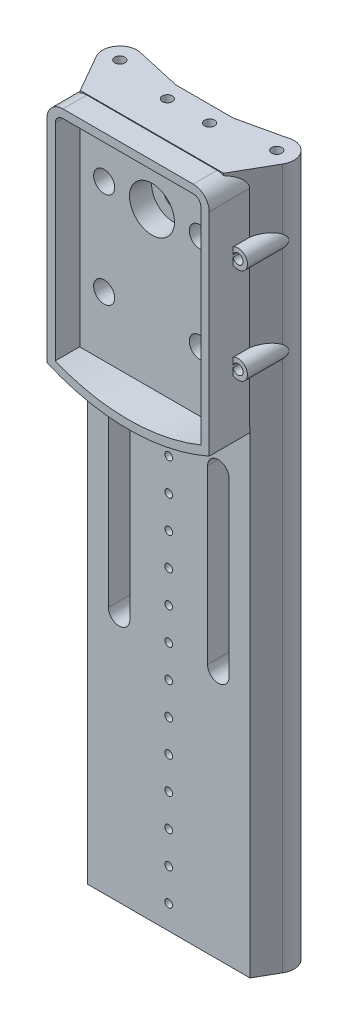
from build123d import *
from build123d.topology import SkipClean

# Parameters (mm, degrees)
SKETCH_2_W             = 60
SKETCH_2_H             = 90
SKETCH_2_R             = 4.4
EXTRUDE_1_DEPTH        = 7
SKETCH_3_R             = 9.4
CUT_EXTRUDE_1_DEPTH    = 29
EXTRUDE_START          = 0.2
SKETCH_5_W             = 60
SKETCH_5_H             = 90
SKETCH_5_R             = 9.4
SKETCH_5_R_2           = 4.4
EXTRUDE_2_DEPTH        = 0.2
SKETCH_6_R             = 6.4
SKETCH_6_R_2           = 2.2
EXTRUDE_3_DEPTH        = 5
SKETCH_8_R             = 10.4
SKETCH_8_R_2           = 9.4
EXTRUDE_4_DEPTH        = 2
SKETCH_9_R             = 6.2
SKETCH_9_R_2           = 4.2
EXTRUDE_6_DEPTH        = 87
EXTRUDE_6_2_DEPTH      = 87
EXTRUDE_6_3_DEPTH      = 87
EXTRUDE_6_4_DEPTH      = 87
EXTRUDE_START_2        = -90
EXTRUDE_11_OUTLINE_R   = 4.2
EXTRUDE_11_DEPTH       = 90
SKETCH_10_R            = 4.2
CUT_EXTRUDE_2_DEPTH    = 74
CUT_EXTRUDE_START      = -9.2
SKETCH_12_R            = 9.4
CUT_EXTRUDE_3_DEPTH    = 9.2
SKETCH_13_R            = 5.394379646
SKETCH_13_R_2          = 5.554961838
EXTRUDE_13_DEPTH       = 5
SKETCH_14_R            = 2.1
SKETCH_14_R_2          = 4.2
CUT_EXTRUDE_4_DEPTH    = 88
SKETCH_15_R            = 2.1
EXTRUDE_16_DEPTH       = 3
EXTRUDE_START_3        = 200
SKETCH_16_R            = 4.2
EXTRUDE_17_DEPTH       = 200
EXTRUDE_19_DEPTH       = 10
SKETCH_26_R            = 1.6
CUT_EXTRUDE_5_DEPTH    = 30
SKETCH_28_R            = 1.6
CUT_EXTRUDE_6_DEPTH    = 250.016385003
PATTERN_LINEAR_1_COUNT = 10
PATTERN_LINEAR_1_PITCH = 13.5
CUT_EXTRUDE_7_DEPTH    = 250.016385003
SKETCH_33_R            = 1.6
CUT_EXTRUDE_8_DEPTH    = 250.016385003
EXTRUDE_20_REACH       = 251.665
SKETCH_34_R            = 3.927985286
SKETCH_34_R_2          = 2.1
EXTRUDE_21_REACH       = 251.665
SKETCH_36_R            = 3.927985286
SKETCH_36_R_2          = 2.1


# Read off the part's stored shape, not the designer's step: 凸台-拉伸11
with BuildPart() as part:
    # 草图2 → 凸台-拉伸1 (new body)
    with BuildSketch(Plane.XY):
        Rectangle(SKETCH_2_W, SKETCH_2_H)
        with Locations((20, 20)):
            Circle(SKETCH_2_R, mode=Mode.SUBTRACT)
        with Locations((-20, 20)):
            Circle(SKETCH_2_R, mode=Mode.SUBTRACT)
        with Locations((-20, -20)):
            Circle(SKETCH_2_R, mode=Mode.SUBTRACT)
        with Locations((20, -20)):
            Circle(SKETCH_2_R, mode=Mode.SUBTRACT)
    extrude(amount=EXTRUDE_1_DEPTH)

    # 草图3 → 切除-拉伸1 (cut)
    with BuildSketch(Plane(origin=(0, 0, 0), x_dir=(-1, 0, 0), z_dir=(0, 0, -1))):
        with Locations((0, 20)):
            Circle(SKETCH_3_R)
    extrude(amount=-CUT_EXTRUDE_1_DEPTH, mode=Mode.SUBTRACT)

    # 草图5 → 凸台-拉伸2 (add)
    with SkipClean():  # the faces are left unmerged after this step: merging them gives an invalid solid
        with BuildSketch(Plane(origin=(0, 0, 0), x_dir=(-1, 0, 0), z_dir=(0, 0, -1)).offset(EXTRUDE_START)):
            Rectangle(SKETCH_5_W, SKETCH_5_H)
            with Locations((0, 20)):
                Circle(SKETCH_5_R, mode=Mode.SUBTRACT)
            with Locations((-20, 20)):
                Circle(SKETCH_5_R_2, mode=Mode.SUBTRACT)
            with Locations((20, 20)):
                Circle(SKETCH_5_R_2, mode=Mode.SUBTRACT)
            with Locations((-20, -20)):
                Circle(SKETCH_5_R_2, mode=Mode.SUBTRACT)
            with Locations((20, -20)):
                Circle(SKETCH_5_R_2, mode=Mode.SUBTRACT)
        extrude(amount=-EXTRUDE_2_DEPTH)

    # 草图6 → 凸台-拉伸3 (add)
    # profile 1 of 4: a face of its own
    with SkipClean():  # the faces are left unmerged after this step: merging them gives an invalid solid
        with BuildSketch(Plane(origin=(0, 0, -0.2), x_dir=(-1, 0, 0), z_dir=(0, 0, -1))):
            with Locations((-20, 20)):
                Circle(SKETCH_6_R)
            with Locations((-20, 20)):
                Circle(SKETCH_6_R_2, mode=Mode.SUBTRACT)
        # profile 2 of 4: a face of its own
        with BuildSketch(Plane(origin=(0, 0, -0.2), x_dir=(-1, 0, 0), z_dir=(0, 0, -1))):
            with Locations((20, 20)):
                Circle(SKETCH_6_R)
            with Locations((20, 20)):
                Circle(SKETCH_6_R_2, mode=Mode.SUBTRACT)
        # profile 3 of 4: a face of its own
        with BuildSketch(Plane(origin=(0, 0, -0.2), x_dir=(-1, 0, 0), z_dir=(0, 0, -1))):
            with Locations((-20, -20)):
                Circle(SKETCH_6_R)
            with Locations((-20, -20)):
                Circle(SKETCH_6_R_2, mode=Mode.SUBTRACT)
        # profile 4 of 4: a face of its own
        with BuildSketch(Plane(origin=(0, 0, -0.2), x_dir=(-1, 0, 0), z_dir=(0, 0, -1))):
            with Locations((20, -20)):
                Circle(SKETCH_6_R)
            with Locations((20, -20)):
                Circle(SKETCH_6_R_2, mode=Mode.SUBTRACT)
        extrude(amount=EXTRUDE_3_DEPTH)

    # 草图8 → 凸台-拉伸4 (add)
    with SkipClean():  # the faces are left unmerged after this step: merging them gives an invalid solid
        with BuildSketch(Plane(origin=(0, 0, -0.2), x_dir=(-1, 0, 0), z_dir=(0, 0, -1))):
            with Locations((-0.054578781, 20.238018036)):
                Circle(SKETCH_8_R)
            with Locations(Location((-0.054578781, 20.238018036, 0), (0, 0, 193.659194288))):
                Circle(SKETCH_8_R_2, mode=Mode.SUBTRACT)
        extrude(amount=EXTRUDE_4_DEPTH)



with BuildPart() as body_2:
    # 草图9 → 凸台-拉伸6 (new body)
    with BuildSketch(Plane.XZ.offset(45)):
        with Locations(Location((32.8, -12.4, 0), (0, 0, 270))):
            Circle(SKETCH_9_R)
        with Locations(Location((32.8, -12.4, 0), (0, 0, 270))):
            Circle(SKETCH_9_R_2, mode=Mode.SUBTRACT)
    extrude(amount=-EXTRUDE_6_DEPTH)


with BuildPart() as body_3:
    # 草图9 → Extrude 6 2 (new body)
    with BuildSketch(Plane.XZ.offset(45)):
        with Locations(Location((-32.727985286, -12.279985317, 0), (0, 0, 90))):
            Circle(SKETCH_9_R)
        with Locations(Location((-32.727985286, -12.279985317, 0), (0, 0, 90))):
            Circle(SKETCH_9_R_2, mode=Mode.SUBTRACT)
    extrude(amount=-EXTRUDE_6_2_DEPTH)


with BuildPart() as body_4:
    # 草图9 → Extrude 6 3 (new body)
    with BuildSketch(Plane.XZ.offset(45)):
        with BuildLine():
            Line((8.866995315, -4.032292114), (10.646326686, -3.444094386))
            Line((10.646326686, -3.444094386), (12.412827061, -4.710086322))
            Line((12.412827061, -4.710086322), (13.914352381, -7.919228671))
            Line((13.914352381, -7.919228671), (13.354960595, -12.432263937))
            Line((13.354960595, -12.432263937), (12.736803026, -14.246535718))
            Line((12.736803026, -14.246535718), (8.829632785, -14.232223684))
            Line((8.829632785, -14.232223684), (8.836226172, -12.43223576))
            ThreePointArc((8.836226172, -12.43223576), (13.051582567, -8.247648508), (8.866995315, -4.032292114))
        make_face()
    extrude(amount=-EXTRUDE_6_3_DEPTH)


with BuildPart() as body_5:
    # 草图9 → Extrude 6 4 (new body)
    with BuildSketch(Plane.XZ.offset(45)):
        with BuildLine():
            Line((-8.764490306, -4), (-10.541655175, -3.405288539))
            Line((-10.541655175, -3.405288539), (-12.312781019, -4.664801303))
            Line((-12.312781019, -4.664801303), (-13.826051332, -7.868422046))
            Line((-13.826051332, -7.868422046), (-13.283194516, -12.383476083))
            Line((-13.283194516, -12.383476083), (-12.671686759, -14.2))
            Line((-12.671686759, -14.2), (-8.764490306, -14.2))
            Line((-8.764490306, -14.2), (-8.764490306, -12.4))
            ThreePointArc((-8.764490306, -12.4), (-12.964490306, -8.2), (-8.764490306, -4))
        make_face()
    extrude(amount=-EXTRUDE_6_4_DEPTH)


with BuildPart() as part_1:
    with SkipClean():  # the faces are left unmerged after this step: merging them gives an invalid solid
        add(part.part)

        add(body_2.part)  # 凸台-拉伸11 merges body 2

        add(body_3.part)  # 凸台-拉伸11 merges body 3

        add(body_4.part)  # 凸台-拉伸11 merges body 4

        add(body_5.part)  # 凸台-拉伸11 merges body 5
        # 凸台-拉伸11 outline → 凸台-拉伸11 (add)
        with BuildSketch(Plane(origin=(0, 45, 0), x_dir=(1, 0, 0), z_dir=(0, 1, 0)).offset(EXTRUDE_START_2)):
            with BuildLine():
                Line((12, 15), (-12, 15))
                Line((-12, 15), (-31.148828374, 19.304674879))
                ThreePointArc((-31.148828374, 19.304674879), (-38.518924765, 16.558421942), (-38.978742897, 8.706747388))
                Line((-38.978742897, 8.706747388), (-30, -7))
                Line((-30, -7), (-30, 0.2))
                Line((-30, 0.2), (30, 0.2))
                Line((30, 0.2), (30, -7))
                Line((30, -7), (38.945754269, 8.649039527))
                ThreePointArc((38.945754269, 8.649039527), (38.279214713, 17.070996267), (30.068858697, 19.061896666))
                Line((30.068858697, 19.061896666), (12, 15))
            make_face()
            with Locations((-8.764490306, 8.2)):
                Circle(EXTRUDE_11_OUTLINE_R, mode=Mode.SUBTRACT)
            with Locations((8.851610744, 8.232263937)):
                Circle(EXTRUDE_11_OUTLINE_R, mode=Mode.SUBTRACT)
            with Locations((-32.727985286, 12.279985317)):
                Circle(EXTRUDE_11_OUTLINE_R, mode=Mode.SUBTRACT)
            with Locations((32.8, 12.4)):
                Circle(EXTRUDE_11_OUTLINE_R, mode=Mode.SUBTRACT)
        extrude(amount=EXTRUDE_11_DEPTH)

    # 草图10 → 切除-拉伸2 (cut)
    with SkipClean():  # the faces are left unmerged after this step: merging them gives an invalid solid
        with BuildSketch(Plane(origin=(0, 0, -0.2), x_dir=(-1, 0, 0), z_dir=(0, 0, -1))):
            with Locations((-20, 20)):
                Circle(SKETCH_10_R)
            with Locations(Location((20, 20, 0), (0, 0, 180))):
                Circle(SKETCH_10_R)
            with Locations(Location((20, -20, 0), (0, 0, 180))):
                Circle(SKETCH_10_R)
            with Locations(Location((-20, -20, 0), (0, 0, 180))):
                Circle(SKETCH_10_R)
        extrude(amount=CUT_EXTRUDE_2_DEPTH, mode=Mode.SUBTRACT)

    # 草图12 → 切除-拉伸3 (cut)
    with SkipClean():  # the faces are left unmerged after this step: merging them gives an invalid solid
        with BuildSketch(Plane.XY.offset(7).offset(CUT_EXTRUDE_START)):
            with Locations((0, 20)):
                Circle(SKETCH_12_R)
        extrude(amount=CUT_EXTRUDE_3_DEPTH, mode=Mode.SUBTRACT)

    # 草图13 → 凸台-拉伸13 (add)
    with SkipClean():  # the faces are left unmerged after this step: merging them gives an invalid solid
        with BuildSketch(Plane.XY.offset(-0.2)):
            with Locations((-20, 20)):
                Circle(SKETCH_13_R)
            with Locations((-20, -20)):
                Circle(SKETCH_13_R_2)
            with Locations((20, -20)):
                Circle(SKETCH_13_R_2)
            with Locations((20, 20)):
                Circle(SKETCH_13_R)
        extrude(amount=-EXTRUDE_13_DEPTH)

    # 草图14 → 切除-拉伸4 (cut)
    with SkipClean():  # the faces are left unmerged after this step: merging them gives an invalid solid
        with BuildSketch(Plane.XY.offset(7)):
            with Locations((-20, 20)):
                Circle(SKETCH_14_R)
            with Locations(Location((20, 20, 0), (0, 0, 180))):
                Circle(SKETCH_14_R)
            with Locations(Location((20, -20, 0), (0, 0, 180))):
                Circle(SKETCH_14_R)
            with Locations((-20, -20)):
                Circle(SKETCH_14_R)
            with Locations((0, 20)):
                Circle(SKETCH_14_R_2)
        extrude(amount=-CUT_EXTRUDE_4_DEPTH, mode=Mode.SUBTRACT)

    # 草图15 → 凸台-拉伸16 (add)
    with SkipClean():  # the faces are left unmerged after this step: merging them gives an invalid solid
        with BuildSketch(Plane(origin=(0, 45, 0), x_dir=(1, 0, 0), z_dir=(0, 1, 0))):
            with BuildLine():
                Line((30.068858697, 19.061896666), (12, 15))
                Line((12, 15), (-12, 15))
                Line((-12, 15), (-31.148828374, 19.304674879))
                ThreePointArc((-31.148828374, 19.304674879), (-38.518924765, 16.558421942), (-38.978742897, 8.706747388))
                Line((-38.978742897, 8.706747388), (-30, -7))
                Line((-30, -7), (30, -7))
                Line((30, -7), (38.945754269, 8.649039527))
                ThreePointArc((38.945754269, 8.649039527), (38.279214713, 17.070996267), (30.068858697, 19.061896666))
            make_face()
            with Locations(Location((-32.727985286, 12.279985317, 0), (0, 0, 270))):
                Circle(SKETCH_15_R, mode=Mode.SUBTRACT)
            with Locations(Location((-8.764490306, 8.2, 0), (0, 0, 270))):
                Circle(SKETCH_15_R, mode=Mode.SUBTRACT)
            with Locations(Location((8.851610744, 8.232263937, 0), (0, 0, 270))):
                Circle(SKETCH_15_R, mode=Mode.SUBTRACT)
            with Locations(Location((32.8, 12.4, 0), (0, 0, 270))):
                Circle(SKETCH_15_R, mode=Mode.SUBTRACT)
        extrude(amount=EXTRUDE_16_DEPTH)

    # 草图16 → 凸台-拉伸17 (add)
    with SkipClean():  # the faces are left unmerged after this step: merging them gives an invalid solid
        with BuildSketch(Plane.XZ.offset(45).offset(EXTRUDE_START_3)):
            with BuildLine():
                Line((-34.001541422, 0), (34.001541422, 0))
                Line((34.001541422, 0), (38.945754269, -8.649039527))
                ThreePointArc((38.945754269, -8.649039527), (38.279214713, -17.070996267), (30.068858697, -19.061896666))
                Line((30.068858697, -19.061896666), (12, -15))
                Line((12, -15), (-12, -15))
                Line((-12, -15), (-31.148828374, -19.304674879))
                ThreePointArc((-31.148828374, -19.304674879), (-38.518924765, -16.558421942), (-38.978742897, -8.706747388))
                Line((-38.978742897, -8.706747388), (-34.001541422, 0))
            make_face()
            with Locations(Location((-32.727985286, -12.279985317, 0), (0, 0, 90))):
                Circle(SKETCH_16_R, mode=Mode.SUBTRACT)
            with Locations(Location((-8.764490306, -8.2, 0), (0, 0, 90))):
                Circle(SKETCH_16_R, mode=Mode.SUBTRACT)
            with Locations(Location((8.851610744, -8.232263937, 0), (0, 0, 90))):
                Circle(SKETCH_16_R, mode=Mode.SUBTRACT)
            with Locations(Location((32.8, -12.4, 0), (0, 0, 90))):
                Circle(SKETCH_16_R, mode=Mode.SUBTRACT)
        extrude(amount=-EXTRUDE_17_DEPTH)

    # 草图24 → 凸台-拉伸19 (add, symmetric)
    with SkipClean():  # the faces are left unmerged after this step: merging them gives an invalid solid
        with BuildSketch(Plane.XY.offset(7)):
            with BuildLine():
                Line((-27.25, 47.7), (27.25, 47.7))
                ThreePointArc((27.25, 47.7), (31.987615434, 45.737615434), (33.95, 41))
                Line((33.95, 41), (33.95, -47.50547366))
                ThreePointArc((33.95, -47.50547366), (0, -54.7), (-33.95, -47.50547366))
                Line((-33.95, -47.50547366), (-33.95, 41))
                ThreePointArc((-33.95, 41), (-31.987615434, 45.737615434), (-27.25, 47.7))
            make_face()
            with BuildLine():
                Line((-27.25, 44.2), (27.25, 44.2))
                ThreePointArc((27.25, 44.2), (29.5127417, 43.2627417), (30.45, 41))
                Line((30.45, 41), (30.45, -45.194592121))
                ThreePointArc((30.45, -45.194592121), (0, -51.2), (-30.45, -45.194592121))
                Line((-30.45, -45.194592121), (-30.45, 41))
                ThreePointArc((-30.45, 41), (-29.5127417, 43.2627417), (-27.25, 44.2))
            make_face(mode=Mode.SUBTRACT)
        extrude(amount=EXTRUDE_19_DEPTH, both=True)

    # 草图26 → 切除-拉伸5 (cut)
    with SkipClean():  # the faces are left unmerged after this step: merging them gives an invalid solid
        with BuildSketch(Plane.XY):
            with Locations((0, -208)):
                Circle(SKETCH_26_R)
            with Locations((0, -235)):
                Circle(SKETCH_26_R)
        extrude(amount=-CUT_EXTRUDE_5_DEPTH, mode=Mode.SUBTRACT)

    # 草图28 → 切除-拉伸6 (cut, through all)
    with SkipClean():  # the faces are left unmerged after this step: merging them gives an invalid solid
        with BuildSketch(Plane.XY):
            with Locations((0, -194.5)):
                Circle(SKETCH_28_R)
        cut_extrude_6 = extrude(amount=-CUT_EXTRUDE_6_DEPTH, mode=Mode.SUBTRACT)

    # 阵列(线性)1: 切除-拉伸6 ×10
    with SkipClean():  # the faces are left unmerged after this step: merging them gives an invalid solid
        with Locations(*[(0, i * PATTERN_LINEAR_1_PITCH, 0) for i in range(1, PATTERN_LINEAR_1_COUNT)]):
            add(cut_extrude_6, mode=Mode.SUBTRACT)

    # 草图30 → 切除-拉伸7 (cut, through all)
    with SkipClean():  # the faces are left unmerged after this step: merging them gives an invalid solid
        with BuildSketch(Plane.XY):
            with BuildLine():
                Line((-16.246237796, -68.360481704), (-16.246237796, -140.360481704))
                ThreePointArc((-16.246237796, -140.360481704), (-20.746237796, -144.860481704), (-25.246237796, -140.360481704))
                Line((-25.246237796, -140.360481704), (-25.246237796, -68.360481704))
                ThreePointArc((-25.246237796, -68.360481704), (-20.746237796, -63.860481704), (-16.246237796, -68.360481704))
            make_face()
            with BuildLine():
                Line((16.246237796, -68.360481704), (16.246237796, -140.360481704))
                ThreePointArc((16.246237796, -140.360481704), (20.746237796, -144.860481704), (25.246237796, -140.360481704))
                Line((25.246237796, -140.360481704), (25.246237796, -68.360481704))
                ThreePointArc((25.246237796, -68.360481704), (20.746237796, -63.860481704), (16.246237796, -68.360481704))
            make_face()
        extrude(amount=-CUT_EXTRUDE_7_DEPTH, mode=Mode.SUBTRACT)

    # 草图33 → 切除-拉伸8 (cut, through all)
    with SkipClean():  # the faces are left unmerged after this step: merging them gives an invalid solid
        with BuildSketch(Plane.XY):
            with Locations((0, -221.5)):
                Circle(SKETCH_33_R)
        extrude(amount=-CUT_EXTRUDE_8_DEPTH, mode=Mode.SUBTRACT)

    # 凸台-拉伸20: up to this plane
    with SkipClean():  # the faces are left unmerged after this step: merging them gives an invalid solid
        extrude_20_end = Plane(origin=(-25.627068489, -129.238012986, 14.649682297), z_dir=(0.8681607792697689, 0, -0.4962830455876039))
        # 草图34 → 凸台-拉伸20 (add, up to the surface)
        with BuildSketch(Plane.XY.offset(7), mode=Mode.PRIVATE) as extrude_20_sk1:
            with Locations((-36, 20)):
                Circle(SKETCH_34_R)
            with Locations((-36, 20)):
                Circle(SKETCH_34_R_2, mode=Mode.SUBTRACT)
        extrude_20_tool1 = split(extrude(extrude_20_sk1.sketch, amount=-EXTRUDE_20_REACH, mode=Mode.PRIVATE), bisect_by=extrude_20_end, keep=Keep.BOTH, mode=Mode.PRIVATE)
        add(extrude_20_tool1.solids().sort_by_distance((-39.816885, 20, 7))[0])
        # 草图34 → 凸台-拉伸20 (add, up to the surface)
        with BuildSketch(Plane.XY.offset(7), mode=Mode.PRIVATE) as extrude_20_sk2:
            with Locations((-36, -20)):
                Circle(SKETCH_34_R)
            with Locations((-36, -20)):
                Circle(SKETCH_34_R_2, mode=Mode.SUBTRACT)
        extrude_20_tool2 = split(extrude(extrude_20_sk2.sketch, amount=-EXTRUDE_20_REACH, mode=Mode.PRIVATE), bisect_by=extrude_20_end, keep=Keep.BOTH, mode=Mode.PRIVATE)
        add(extrude_20_tool2.solids().sort_by_distance((-39.816885, -20, 7))[0])

    # 凸台-拉伸21: up to this plane
    with SkipClean():  # the faces are left unmerged after this step: merging them gives an invalid solid
        extrude_21_end = Plane(origin=(25.627068489, -129.238012986, 14.649682297), z_dir=(0.8681607792697689, 0, 0.4962830455876039))
        # 草图36 → 凸台-拉伸21 (add, up to the surface)
        with BuildSketch(Plane.XY.offset(7), mode=Mode.PRIVATE) as extrude_21_sk1:
            with Locations((36, -20)):
                Circle(SKETCH_36_R)
            with Locations((36, -20)):
                Circle(SKETCH_36_R_2, mode=Mode.SUBTRACT)
        extrude_21_tool1 = split(extrude(extrude_21_sk1.sketch, amount=-EXTRUDE_21_REACH, mode=Mode.PRIVATE), bisect_by=extrude_21_end, keep=Keep.BOTH, mode=Mode.PRIVATE)
        add(extrude_21_tool1.solids().sort_by_distance((32.183115, -20, 7))[0])
        # 草图36 → 凸台-拉伸21 (add, up to the surface)
        with BuildSketch(Plane.XY.offset(7), mode=Mode.PRIVATE) as extrude_21_sk2:
            with Locations((36, 20)):
                Circle(SKETCH_36_R)
            with Locations((36, 20)):
                Circle(SKETCH_36_R_2, mode=Mode.SUBTRACT)
        extrude_21_tool2 = split(extrude(extrude_21_sk2.sketch, amount=-EXTRUDE_21_REACH, mode=Mode.PRIVATE), bisect_by=extrude_21_end, keep=Keep.BOTH, mode=Mode.PRIVATE)
        add(extrude_21_tool2.solids().sort_by_distance((32.183115, 20, 7))[0])


solid = part_1.part
